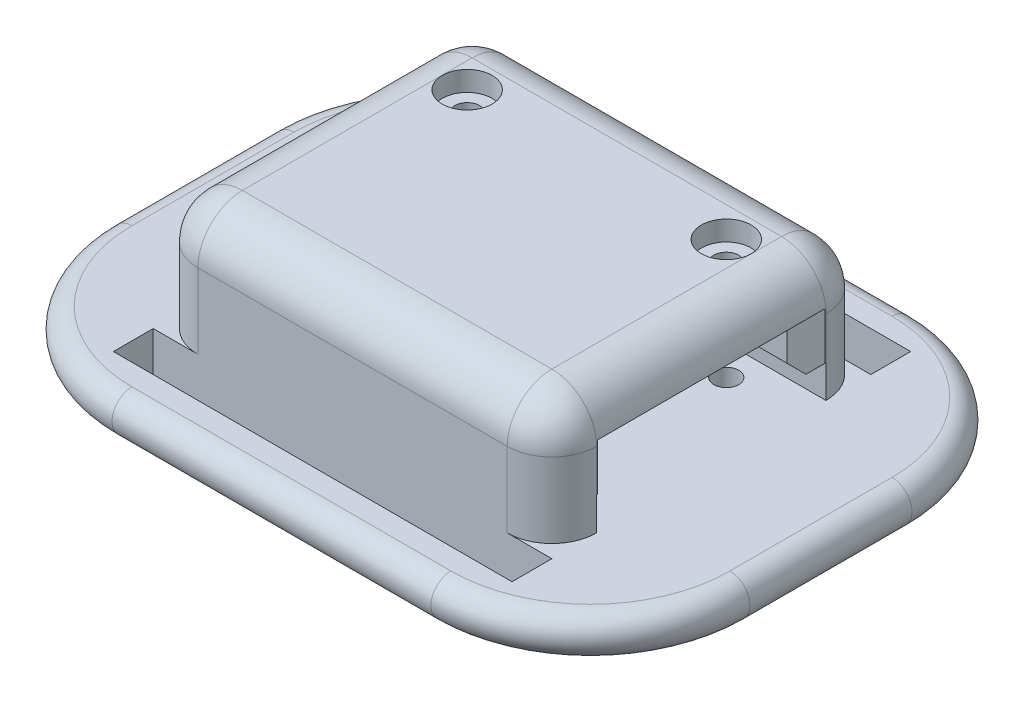
from build123d import *

# Parameters (mm, degrees)
SKETCH1_W               = 31.75
SKETCH1_H               = 25.4
BOSS_EXTRUDE1_DEPTH     = 12.7
SKETCH2_W               = 18.25625
SKETCH2_H               = 6.35
CUT_EXTRUDE3_DEPTH      = 39.058949894
SKETCH4_W               = 1.5875
SKETCH4_H               = 4.7625
BOSS_EXTRUDE2_DEPTH     = 31.75
CUT_EXTRUDE5_DEPTH      = 31.590858593
CUT_EXTRUDE5_DEPTH_BACK = 31.590858593
SKETCH5_R               = 0.9921875
CUT_EXTRUDE6_DEPTH      = 1.5875
SKETCH7_R               = 1.984375
CUT_EXTRUDE7_DEPTH      = 1.5875
SKETCH8_W               = 50.8
SKETCH8_H               = 38.305926372
SKETCH8_W_2             = 31.75
SKETCH8_H_2             = 25.4
BOSS_EXTRUDE3_DEPTH     = 3.175
SKETCH10_W              = 31.75
SKETCH10_H              = 3.175
CUT_EXTRUDE8_DEPTH      = 42.677098196
FILLET6_R               = 12.7
CHAMFER1_SIZE           = 1.016
CHAMFER2_SIZE           = 1.524
FILLET7_R               = 3.556
FILLET10_R              = 1.5875


# Some blends are built 0.0001 mm under size
with BuildPart() as part:
    # Sketch1 → Boss-Extrude1 (new body)
    with BuildSketch(Plane(origin=(0, 0, 0), x_dir=(1, 0, 0), z_dir=(0, 1, 0))):
        with Locations((7.914574134, 4.007219009)):
            Rectangle(SKETCH1_W, SKETCH1_H)
    extrude(amount=BOSS_EXTRUDE1_DEPTH)

    # Sketch2 → Cut-Extrude3 (cut, through all)
    with BuildSketch(Plane(origin=(23.789574134, 0, 0), x_dir=(0, 0, -1), z_dir=(1, 0, 0))):
        with Locations((4.007219009, 6.35)):
            Rectangle(SKETCH2_W, SKETCH2_H)
    extrude(amount=-CUT_EXTRUDE3_DEPTH, mode=Mode.SUBTRACT)

    # Sketch4 → Boss-Extrude2 (add, through all)
    with BuildSketch(Plane(origin=(23.789574134, 0, 0), x_dir=(0, 0, -1), z_dir=(1, 0, 0))):
        with Locations((-4.327155991, 7.14375)):
            Rectangle(SKETCH4_W, SKETCH4_H)
        with Locations((12.341594009, 7.14375)):
            Rectangle(SKETCH4_W, SKETCH4_H)
    extrude(amount=-BOSS_EXTRUDE2_DEPTH)

    # Sketch5 → Cut-Extrude5 (cut, two sides: drawn at the far end of the back side and taken through both)
    with BuildSketch(Plane(origin=(0, 3.175, 0), x_dir=(1, 0, 0), z_dir=(0, 1, 0)).offset(-CUT_EXTRUDE5_DEPTH_BACK)):
        with Locations(Location((-2.404175866, 10.754094009, 0), (0, 0, 270))):
            Circle(SKETCH5_R)
        with Locations(Location((18.233324134, 10.754094009, 0), (0, 0, 126.869897646))):
            Circle(SKETCH5_R)
    extrude(amount=CUT_EXTRUDE5_DEPTH + CUT_EXTRUDE5_DEPTH_BACK, mode=Mode.SUBTRACT)

    # Sketch6 → Cut-Extrude6 (cut)
    with BuildSketch(Plane.XZ):
        Polygon((-0.022925866, -10.754094009), (-1.213550866, -8.691871016), (-3.594800866, -8.691871016), (-4.785425866, -10.754094009), (-3.594800866, -12.816317002), (-1.213550866, -12.816317002), align=None)
        Polygon((20.614574134, -10.754094009), (19.423949134, -8.691871016), (17.042699134, -8.691871016), (15.852074134, -10.754094009), (17.042699134, -12.816317002), (19.423949134, -12.816317002), align=None)
    extrude(amount=-CUT_EXTRUDE6_DEPTH, mode=Mode.SUBTRACT)

    # Sketch7 → Cut-Extrude7 (cut)
    with BuildSketch(Plane(origin=(0, 12.7, 0), x_dir=(1, 0, 0), z_dir=(0, 1, 0))):
        with Locations(Location((-2.404175866, 10.754094009, 0), (0, 0, 270))):
            Circle(SKETCH7_R)
        with Locations(Location((18.233324134, 10.754094009, 0), (0, 0, 270))):
            Circle(SKETCH7_R)
    extrude(amount=-CUT_EXTRUDE7_DEPTH, mode=Mode.SUBTRACT)

    # Sketch8 → Boss-Extrude3 (add)
    with BuildSketch(Plane.XZ):
        with Locations((7.914574134, -4.007219009)):
            Rectangle(SKETCH8_W, SKETCH8_H)
        with Locations((7.914574134, -4.007219009)):
            Rectangle(SKETCH8_W_2, SKETCH8_H_2, mode=Mode.SUBTRACT)
    extrude(amount=-BOSS_EXTRUDE3_DEPTH)

    # Sketch10 → Cut-Extrude8 (cut, through all)
    with BuildSketch(Plane(origin=(0, 3.175, 0), x_dir=(1, 0, 0), z_dir=(0, 1, 0))):
        with Locations((7.914574134, 18.294719009)):
            Rectangle(SKETCH10_W, SKETCH10_H)
        with Locations((7.914574134, -10.280280991)):
            Rectangle(SKETCH10_W, SKETCH10_H)
    extrude(amount=-CUT_EXTRUDE8_DEPTH, mode=Mode.SUBTRACT)

    # Fillet6
    fillet6_edges = [part.edges().sort_by_distance(p)[0] for p in [
        (-17.485425866, 1.5875, 15.145744177),
        (33.314574134, 1.5875, 15.145744177),
        (33.314574134, 1.5875, -23.160182195),
        (-17.485425866, 1.5875, -23.160182195),
    ]]
    fillet(fillet6_edges, radius=FILLET6_R)

    # Chamfer1
    # the kernel refuses this chamfer: 1.016 mm, written as the material it takes off along each edge
    with BuildSketch(Plane(origin=(-7.960425866, 4.7625, 0.920576075), x_dir=(-0.027495876610586435, 0.9996219169112968, 0), z_dir=(0, 0, 1)), Plane(origin=(-7.960425866, 4.7625, -13.135344009), x_dir=(-0.027495876610586435, 0.9996219169112968, 1.1185418764848949e-15), z_dir=(0, 0, 1))) as chamfer1_piece_1:
        Polygon((CHAMFER1_SIZE * 0.999621916911, -CHAMFER1_SIZE * 0.0274958766106), (-CHAMFER1_SIZE * 0.0274958766106, -CHAMFER1_SIZE * 0.999621916911), (0, 0), align=None)
    extrude(amount=4.200329916, mode=Mode.SUBTRACT)
    with BuildSketch(Plane(origin=(26.402404049, 4.7625, 3.533405991), x_dir=(0, 0.9996219169112968, -0.027495876610586435), z_dir=(-1, 0, 0))) as chamfer1_piece_2:
        Polygon((CHAMFER1_SIZE * 0.999621916911, -CHAMFER1_SIZE * 0.0274958766106), (-CHAMFER1_SIZE * 0.0274958766106, -CHAMFER1_SIZE * 0.999621916911), (0, 0), align=None)
    extrude(amount=36.975659832, mode=Mode.SUBTRACT)
    with BuildSketch(Plane(origin=(23.789574134, 4.7625, 0.920576075), x_dir=(0.027495876610587285, 0.9996219169112968, 0), z_dir=(0, 0, 1)), Plane(origin=(23.789574134, 4.7625, -13.135344009), x_dir=(0.027495876610587285, 0.9996219169112968, 1.1185418764848949e-15), z_dir=(0, 0, 1))) as chamfer1_piece_3:
        Polygon((CHAMFER1_SIZE * 0.999621916911, CHAMFER1_SIZE * 0.0274958766106), (-CHAMFER1_SIZE * 0.0274958766106, CHAMFER1_SIZE * 0.999621916911), (0, 0), align=None)
    extrude(amount=4.200329916, mode=Mode.SUBTRACT)
    with BuildSketch(Plane(origin=(-0.386658451, 4.7625, -11.547844009), x_dir=(0, -0.027495876610585605, -0.9996219169112968), z_dir=(-1, 0, 0)), Plane(origin=(26.402404049, 4.7625, -11.547844009), x_dir=(0, -0.027495876610585605, -0.9996219169112968), z_dir=(-1, 0, 0))) as chamfer1_piece_4:
        Polygon((CHAMFER1_SIZE * 0.999621916911, -CHAMFER1_SIZE * 0.0274958766106), (-CHAMFER1_SIZE * 0.0274958766106, -CHAMFER1_SIZE * 0.999621916911), (0, 0), align=None)
    extrude(amount=10.186597332, mode=Mode.SUBTRACT)
    with BuildSketch(Plane(origin=(20.250841549, 4.7625, -11.547844009), x_dir=(0, -0.027495876610585605, -0.9996219169112968), z_dir=(-1, 0, 0))) as chamfer1_piece_5:
        Polygon((CHAMFER1_SIZE * 0.999621916911, -CHAMFER1_SIZE * 0.0274958766106), (-CHAMFER1_SIZE * 0.0274958766106, -CHAMFER1_SIZE * 0.999621916911), (0, 0), align=None)
    extrude(amount=24.672534832, mode=Mode.SUBTRACT)

    # Chamfer2
    chamfer2_edges = [part.edges().sort_by_distance(p)[0] for p in [
        (-7.960425866, 7.65175, 3.533405991),
        (23.789574134, 7.65175, 3.533405991),
        (-7.960425866, 7.65175, -11.547844009),
        (23.789574134, 7.65175, -11.547844009),
    ]]
    chamfer(chamfer2_edges, length=CHAMFER2_SIZE)

    # Fillet7
    # the kernel refuses this fillet: 3.556 mm, written as the material it takes off along each edge
    with BuildSketch(Plane(origin=(20.233574134, 9.144, 5.136780991), x_dir=(0, 0, 1), z_dir=(1, 0, 0))) as fillet7_piece_1_section:
        Polygon((0, 0), (FILLET7_R * 1.02, 0), (FILLET7_R * 1.02, -FILLET7_R * 1.02), (0, -FILLET7_R * 1.02), align=None)
    fillet7_piece_1 = extrude(amount=FILLET7_R * 1.02, mode=Mode.PRIVATE)
    fillet7_piece_1 = fillet7_piece_1 - Plane(origin=(20.233574134, 9.144, 5.136780991), x_dir=(0, -0.7071067811865475, -0.7071067811865475), z_dir=(1, 0, 0)) * Sphere(FILLET7_R, mode=Mode.PRIVATE)
    add(fillet7_piece_1, mode=Mode.SUBTRACT)
    with BuildSketch(Plane(origin=(-4.404425866, 9.144, 5.136780991), x_dir=(0, 0, 1), z_dir=(-1, 0, 0))) as fillet7_piece_2_section:
        Polygon((0, 0), (FILLET7_R * 1.02, 0), (FILLET7_R * 1.02, FILLET7_R * 1.02), (0, FILLET7_R * 1.02), align=None)
    fillet7_piece_2 = extrude(amount=FILLET7_R * 1.02, mode=Mode.PRIVATE)
    fillet7_piece_2 = fillet7_piece_2 - Plane(origin=(-4.404425866, 9.144, 5.136780991), x_dir=(0, -0.7071067811865475, -0.7071067811865475), z_dir=(-1, 0, 0)) * Sphere(FILLET7_R, mode=Mode.PRIVATE)
    add(fillet7_piece_2, mode=Mode.SUBTRACT)
    with BuildSketch(Plane(origin=(20.233574134, 9.144, -13.151219009), x_dir=(1, 0, 0), z_dir=(0, 0, -1))) as fillet7_piece_3_section:
        Polygon((0, 0), (FILLET7_R * 1.02, 0), (FILLET7_R * 1.02, -FILLET7_R * 1.02), (0, -FILLET7_R * 1.02), align=None)
    fillet7_piece_3 = extrude(amount=FILLET7_R * 1.02, mode=Mode.PRIVATE)
    fillet7_piece_3 = fillet7_piece_3 - Plane(origin=(20.233574134, 9.144, -13.151219009), x_dir=(-0.7071067811865475, -0.7071067811865475, 0), z_dir=(0, 0, -1)) * Sphere(FILLET7_R, mode=Mode.PRIVATE)
    add(fillet7_piece_3, mode=Mode.SUBTRACT)
    with BuildSketch(Plane(origin=(-4.404425866, 9.144, -13.151219009), x_dir=(-1, 0, 0), z_dir=(0, 0, -1))) as fillet7_piece_4_section:
        Polygon((0, 0), (FILLET7_R * 1.02, 0), (FILLET7_R * 1.02, FILLET7_R * 1.02), (0, FILLET7_R * 1.02), align=None)
    fillet7_piece_4 = extrude(amount=FILLET7_R * 1.02, mode=Mode.PRIVATE)
    fillet7_piece_4 = fillet7_piece_4 - Plane(origin=(-4.404425866, 9.144, -13.151219009), x_dir=(0.7071067811865475, -0.7071067811865475, 0), z_dir=(0, 0, -1)) * Sphere(FILLET7_R, mode=Mode.PRIVATE)
    add(fillet7_piece_4, mode=Mode.SUBTRACT)
    with BuildSketch(Plane(origin=(20.233574134, 12.7, 8.692780991), x_dir=(0, -1, 0), z_dir=(-1, 0, 0))) as fillet7_piece_5:
        with BuildLine():
            CenterArc((FILLET7_R, -FILLET7_R), FILLET7_R, 90, 90)
            Line((0, -FILLET7_R), (0, 0))
            Line((0, 0), (FILLET7_R, 0))
        make_face()
    extrude(amount=24.638, mode=Mode.SUBTRACT)
    with BuildSketch(Plane(origin=(23.789574134, 3.175, 8.692780991), x_dir=(-1, 0, 0), z_dir=(0, 1, 0)), Plane(origin=(-7.960425866, 3.175, -16.707219009), x_dir=(1, 0, 0), z_dir=(0, 1, 0))) as fillet7_piece_6:
        with BuildLine():
            CenterArc((FILLET7_R, -FILLET7_R), FILLET7_R, 90, 90)
            Line((0, -FILLET7_R), (0, 0))
            Line((0, 0), (FILLET7_R, 0))
        make_face()
    extrude(amount=5.969, mode=Mode.SUBTRACT)
    with BuildSketch(Plane(origin=(23.789574134, 12.7, -13.151219009), x_dir=(-1, 0, 0), z_dir=(0, 0, 1)), Plane(origin=(-7.960425866, 12.7, 5.136780991), x_dir=(1, 0, 0), z_dir=(0, 0, -1))) as fillet7_piece_7:
        with BuildLine():
            CenterArc((FILLET7_R, FILLET7_R), FILLET7_R, 180, 90)
            Line((0, FILLET7_R), (0, 0))
            Line((0, 0), (FILLET7_R, 0))
        make_face()
    extrude(amount=18.288, mode=Mode.SUBTRACT)
    with BuildSketch(Plane(origin=(23.789574134, 3.175, -16.707219009), x_dir=(-1, 0, 0), z_dir=(0, 1, 0)), Plane(origin=(-7.960425866, 3.175, 8.692780991), x_dir=(1, 0, 0), z_dir=(0, 1, 0))) as fillet7_piece_8:
        with BuildLine():
            CenterArc((FILLET7_R, FILLET7_R), FILLET7_R, 180, 90)
            Line((0, FILLET7_R), (0, 0))
            Line((0, 0), (FILLET7_R, 0))
        make_face()
    extrude(amount=5.969, mode=Mode.SUBTRACT)
    with BuildSketch(Plane(origin=(-4.404425866, 12.7, -16.707219009), x_dir=(0, 0, 1), z_dir=(1, 0, 0))) as fillet7_piece_9:
        with BuildLine():
            CenterArc((FILLET7_R, FILLET7_R), FILLET7_R, 180, 90)
            Line((0, FILLET7_R), (0, 0))
            Line((0, 0), (FILLET7_R, 0))
        make_face()
    extrude(amount=24.638, mode=Mode.SUBTRACT)

    # Fillet10
    fillet10_edges = [part.edges().sort_by_distance(p)[0] for p in [
        (7.914574134, 3.175, 15.145744177),
        (7.914574134, 0, 15.145744177),
        (-17.485425866, 0, -4.007219009),
        (7.914574134, 0, -23.160182195),
        (33.314574134, 0, -4.007219009),
        (29.594830255, 0, 11.426000298),
        (29.594830255, 0, -19.440438316),
        (-13.765681988, 0, -19.440438316),
        (-13.765681988, 0, 11.426000298),
        (-17.485425866, 3.175, -4.007219009),
        (33.314574134, 3.175, -4.007219009),
        (7.914574134, 3.175, -23.160182195),
    ]]
    fillet(fillet10_edges, radius=FILLET10_R - 0.0001)  # a hair under: the kernel refuses the full size


solid = part.part
